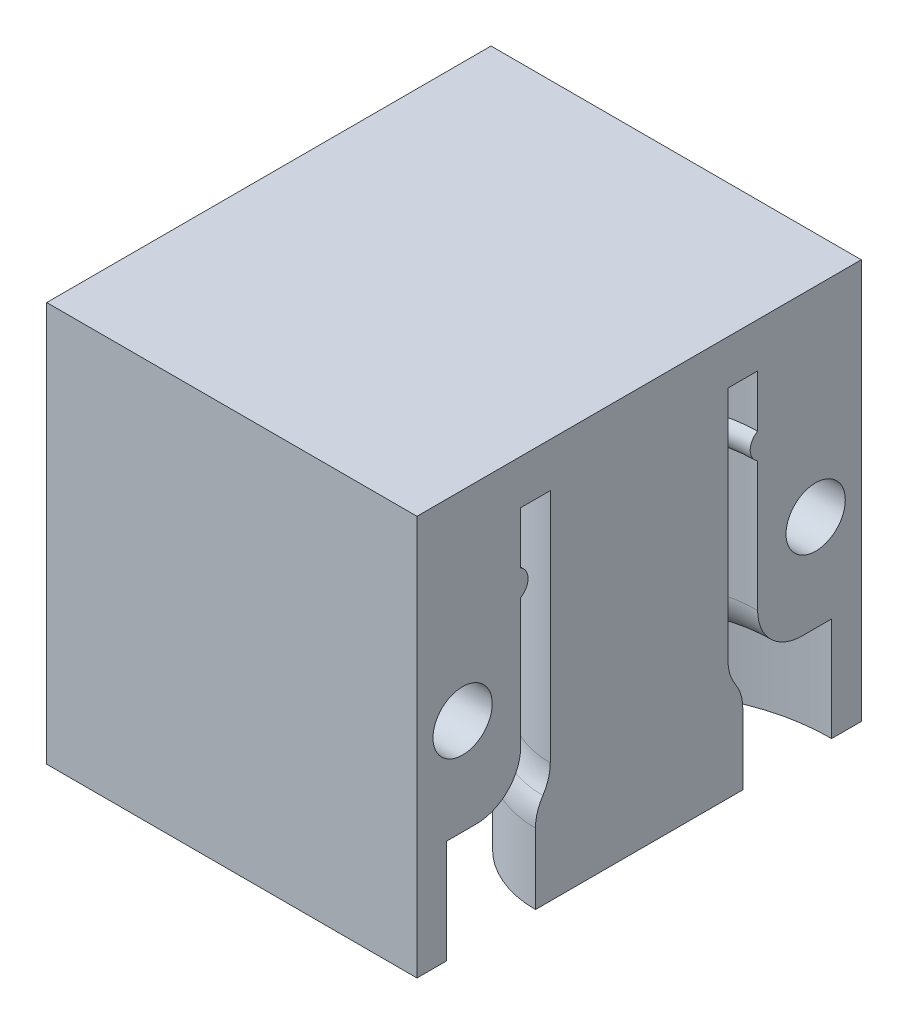
from build123d import *

# Parameters (mm, degrees)
SKETCH1_R            = 7
SKETCH1_R_2          = 2.75
SKETCH1_R_3          = 3.659852489
BOSS_EXTRUDE1_DEPTH  = 7
SKETCH2_R            = 8
SKETCH2_R_2          = 6
BOSS_EXTRUDE2_DEPTH  = 17
FILLET1_R            = 3
FILLET2_R            = 3
SKETCH3_R            = 1
SKETCH5_W            = 50
SKETCH5_H            = 30
BOSS_EXTRUDE3_DEPTH  = 27
SKETCH6_R            = 2
CUT_EXTRUDE1_DEPTH   = 57
INTERSECT3_OUTLINE_W = 27
INTERSECT3_OUTLINE_H = 30
INTERSECT3_OUTLINE_R = 2
INTERSECT3_DEPTH     = 25


with BuildPart() as part:
    # Sketch1 → Boss-Extrude1 (new body)
    with BuildSketch(Plane(origin=(0, 0, 0), x_dir=(1, 0, 0), z_dir=(0, 1, 0))):
        with BuildLine():
            ThreePointArc((-15.634333704, 6.748663161), (-22.25, 0), (-15.634333704, -6.748663161))
            ThreePointArc((-15.634333704, -6.748663161), (-12.054001616, -7.488359295), (-8.978814065, -9.465516285))
            ThreePointArc((-8.978814065, -9.465516285), (-0.448762307, -12.99442036), (8.273320847, -9.971141939))
            ThreePointArc((8.273320847, -9.971141939), (11.493139678, -8.165901558), (15.148520579, -7.651784261))
            ThreePointArc((15.148520579, -7.651784261), (23.159852489, 0), (15.148520579, 7.651784261))
            ThreePointArc((15.148520579, 7.651784261), (11.493139678, 8.165901558), (8.273320847, 9.971141939))
            ThreePointArc((8.273320847, 9.971141939), (-0.448762307, 12.99442036), (-8.978814065, 9.465516285))
            ThreePointArc((-8.978814065, 9.465516285), (-12.054001616, 7.488359295), (-15.634333704, 6.748663161))
        make_face()
        with Locations(Location((0, 0, 0), (0, 0, 270))):
            Circle(SKETCH1_R, mode=Mode.SUBTRACT)
        with Locations(Location((-15.5, 0, 0), (0, 0, 270))):
            Circle(SKETCH1_R_2, mode=Mode.SUBTRACT)
        with Locations(Location((15.5, 0, 0), (0, 0, 270))):
            Circle(SKETCH1_R_3, mode=Mode.SUBTRACT)
    extrude(amount=BOSS_EXTRUDE1_DEPTH)

    # Sketch2 → Boss-Extrude2 (add)
    with BuildSketch(Plane(origin=(0, 7, 0), x_dir=(1, 0, 0), z_dir=(0, 1, 0))):
        with Locations(Location((0, 0, 0), (0, 0, 270))):
            Circle(SKETCH2_R)
        with Locations(Location((0, 0, 0), (0, 0, 270))):
            Circle(SKETCH2_R_2, mode=Mode.SUBTRACT)
    extrude(amount=BOSS_EXTRUDE2_DEPTH)

    # Fillet1
    # the kernel refuses this fillet: 3 mm, written as the material it adds along each edge
    with BuildSketch(Plane(origin=(0, 7, 0), x_dir=(0, 0, 1), z_dir=(-1, 0, 0))) as fillet1_piece_1:
        with BuildLine():
            CenterArc((4, -2.236067977), FILLET1_R, 0, 48.189685104)
            Line((6, 0), (6.04, 0.04472136))
            ThreePointArc((6.04, 0.04472136), (6.5, 0.06), (7, 0.06))
            Line((7, 0.06), (7.06, 0))
            Line((7.06, 0), (7.06, -2.236067977))
            Line((7.06, -2.236067977), (7, -2.236067977))
        make_face()
    revolve(axis=Axis((0, 7, 0), (0, 1, 0)))
    with BuildSketch(Plane(origin=(0, 7, 0), x_dir=(0, 0, 1), z_dir=(-1, 0, 0))) as fillet1_piece_2:
        with BuildLine():
            CenterArc((8 + FILLET1_R, FILLET1_R), FILLET1_R, 180, 90)
            Line((8, FILLET1_R), (8 - FILLET1_R * 0.02, FILLET1_R))
            Line((8 - FILLET1_R * 0.02, FILLET1_R), (8 - FILLET1_R * 0.02, -FILLET1_R * 0.02))
            Line((8 - FILLET1_R * 0.02, -FILLET1_R * 0.02), (8 + FILLET1_R, -FILLET1_R * 0.02))
            Line((8 + FILLET1_R, -FILLET1_R * 0.02), (8 + FILLET1_R, 0))
        make_face()
    revolve(axis=Axis((0, 7, 0), (0, 1, 0)))

    # Fillet2
    fillet2_edges = [part.edges().sort_by_distance(p)[0] for p in [
        (0, 7, -6),
    ]]
    fillet(fillet2_edges, radius=FILLET2_R)


with BuildPart() as body_2:
    # Sketch3 → Revolve1 (revolve)
    with BuildSketch(Plane(origin=(0, 0, 0), x_dir=(0, 0, -1), z_dir=(1, 0, 0))):
        with Locations((8.5, 19.608844607)):
            Circle(SKETCH3_R)
    revolve(axis=Axis((0, 0, 0), (0, 1, 0)))


with BuildPart() as part_1:
    add(part.part)

    # Intersect1: read off the stored shape, not the designer's step
    # Intersect1: cut body 2
    add(body_2.part, mode=Mode.SUBTRACT)


with BuildPart() as body_2_2:
    # Sketch5 → Boss-Extrude3 (new body)
    with BuildSketch(Plane(origin=(0, 0, 0), x_dir=(-1, 0, 0), z_dir=(0, -1, 0))):
        Rectangle(SKETCH5_W, SKETCH5_H)
    extrude(amount=-BOSS_EXTRUDE3_DEPTH)

    # Sketch6 → Cut-Extrude1 (cut)
    with BuildSketch(Plane.ZY.offset(25)):
        with Locations((-11.920412871, 13.5)):
            Circle(SKETCH6_R)
        with Locations(Location((11.920412871, 13.5, 0), (0, 0, 180))):
            Circle(SKETCH6_R)
    extrude(amount=-CUT_EXTRUDE1_DEPTH, mode=Mode.SUBTRACT)

    # Intersect2: read off the stored shape, not the designer's step
    # Intersect2: cut part
    add(part_1.part, mode=Mode.SUBTRACT)

    # Intersect3: read off the stored shape, not the designer's step
    # Intersect3 outline → Intersect3 (cut)
    with BuildSketch(Plane.YZ):
        with Locations((13.5, 0)):
            Rectangle(INTERSECT3_OUTLINE_W, INTERSECT3_OUTLINE_H)
        with Locations((13.5, -11.920412871)):
            Circle(INTERSECT3_OUTLINE_R, mode=Mode.SUBTRACT)
        with Locations((13.5, 11.920412871)):
            Circle(INTERSECT3_OUTLINE_R, mode=Mode.SUBTRACT)
    extrude(amount=INTERSECT3_DEPTH, mode=Mode.SUBTRACT)


solid = body_2_2.part
